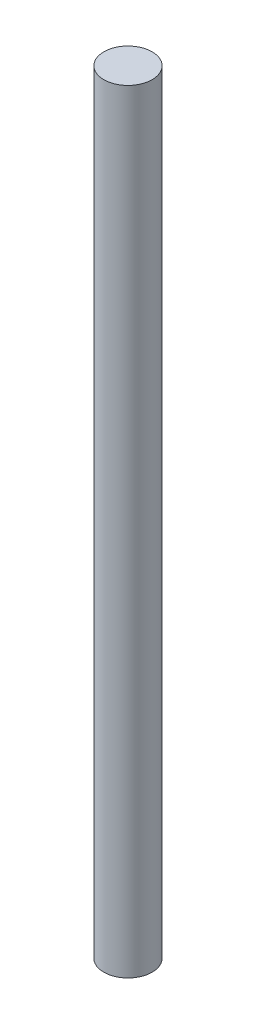
from build123d import *

# Parameters (mm, degrees)
BOSS_EXTRUDE1_DEPTH      = 50.8
BOSS_EXTRUDE1_DEPTH_BACK = 50.8
SKETCH1_R                = 3.175


with BuildPart() as part:
    # Sketch1 → Boss-Extrude1 (new, two sides: drawn at the far end of the back side and taken through both)
    with BuildSketch(Plane(origin=(0, 0, 0), x_dir=(1, 0, 0), z_dir=(0, 1, 0)).offset(-BOSS_EXTRUDE1_DEPTH_BACK)):
        Circle(SKETCH1_R)
    extrude(amount=BOSS_EXTRUDE1_DEPTH + BOSS_EXTRUDE1_DEPTH_BACK)


solid = part.part
